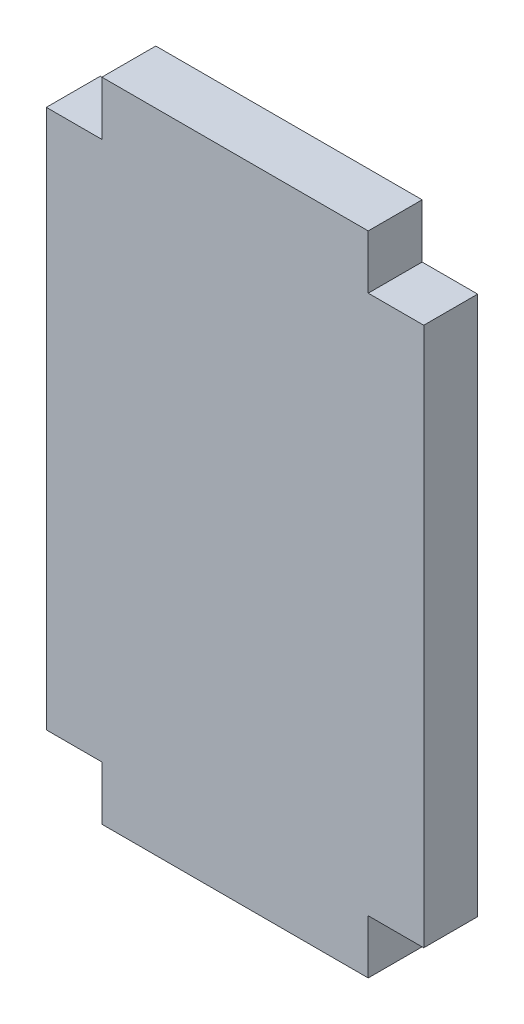
from build123d import *

# Parameters (mm, degrees)
SKETCH1_W           = 35
SKETCH1_H           = 50
BOSS_EXTRUDE1_DEPTH = 5
SKETCH2_W           = 24.7
SKETCH2_H           = 5
BOSS_EXTRUDE2_DEPTH = 5
SKETCH2_2_W         = 24.7
SKETCH2_2_H         = 5
BOSS_EXTRUDE3_DEPTH = 55


with BuildPart() as part:
    # Sketch1 → Boss-Extrude1 (new body)
    with BuildSketch(Plane.XY):
        with Locations((0, 25)):
            Rectangle(SKETCH1_W, SKETCH1_H)
    extrude(amount=BOSS_EXTRUDE1_DEPTH)

    # Sketch2 → Boss-Extrude2 (add)
    with BuildSketch(Plane(origin=(0, 50, 0), x_dir=(1, 0, 0), z_dir=(0, 1, 0))):
        with Locations((0, -2.5)):
            Rectangle(SKETCH2_W, SKETCH2_H)
    extrude(amount=BOSS_EXTRUDE2_DEPTH)

    # Sketch2<2> → Boss-Extrude3 (add)
    with BuildSketch(Plane(origin=(0, 50, 0), x_dir=(1, 0, 0), z_dir=(0, 1, 0))):
        with Locations((0, -2.5)):
            Rectangle(SKETCH2_2_W, SKETCH2_2_H)
    extrude(amount=-BOSS_EXTRUDE3_DEPTH)


solid = part.part
